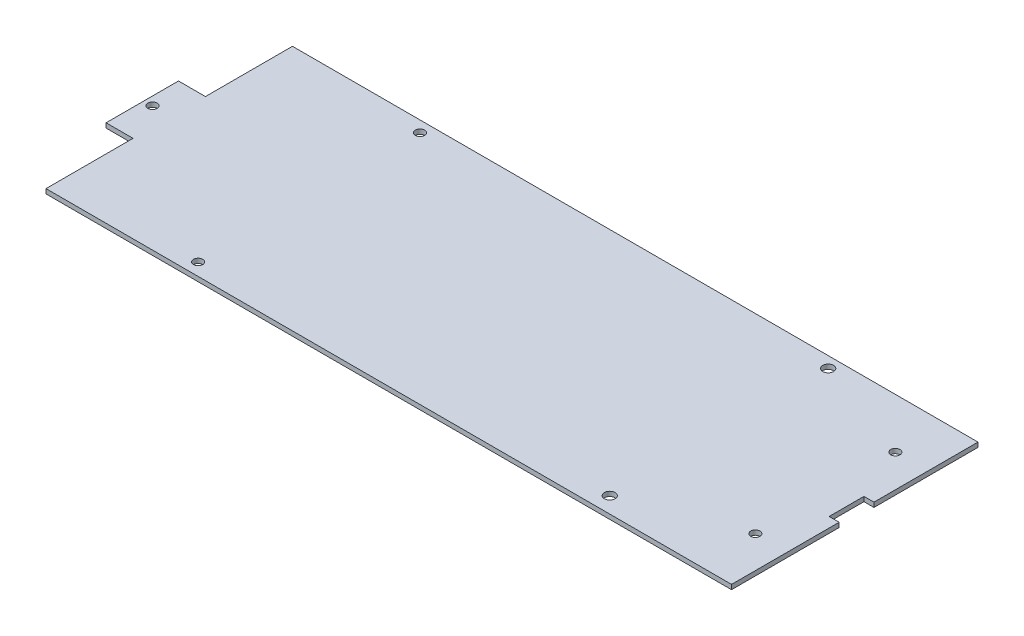
from build123d import *

# Parameters (mm, degrees)
BOSS_EXTRUDE1_START = 2
SKETCH1_R           = 3
SKETCH1_R_2         = 3.5
BOSS_EXTRUDE1_DEPTH = 3


with BuildPart() as part:
    # Sketch1 → Boss-Extrude1 (new body)
    with BuildSketch(Plane(origin=(0, 0, 0), x_dir=(1, 0, 0), z_dir=(0, 1, 0)).offset(BOSS_EXTRUDE1_START)):
        Polygon((-284.735528935, 23.499988432), (-302.235528935, 23.499988432), (-302.235528935, -23.500011568), (-284.735528935, -23.500011568), (-284.735528935, -80.000011568), (160.264471065, -80.000011568), (160.264471065, -10.137920155), (153.764471065, -10.137920155), (153.764471065, 12.462079845), (160.264471065, 12.462079845), (160.264471065, 79.999988432), (-284.735528935, 79.999988432), align=None)
        with Locations((-194.126525875, -71.865831453)):
            Circle(SKETCH1_R, mode=Mode.SUBTRACT)
        with Locations((70.86407833, -69.634311085)):
            Circle(SKETCH1_R_2, mode=Mode.SUBTRACT)
        with Locations((139.486711961, -43.781895297)):
            Circle(SKETCH1_R, mode=Mode.SUBTRACT)
        with Locations((-296.74646616, 1.162079845)):
            Circle(SKETCH1_R, mode=Mode.SUBTRACT)
        with Locations((-194.735528935, 72.773627962)):
            Circle(SKETCH1_R, mode=Mode.SUBTRACT)
        with Locations((139.102370463, 47.499988432)):
            Circle(SKETCH1_R, mode=Mode.SUBTRACT)
        with Locations((70.264471065, 72.773627962)):
            Circle(SKETCH1_R_2, mode=Mode.SUBTRACT)
    extrude(amount=BOSS_EXTRUDE1_DEPTH)


solid = part.part
